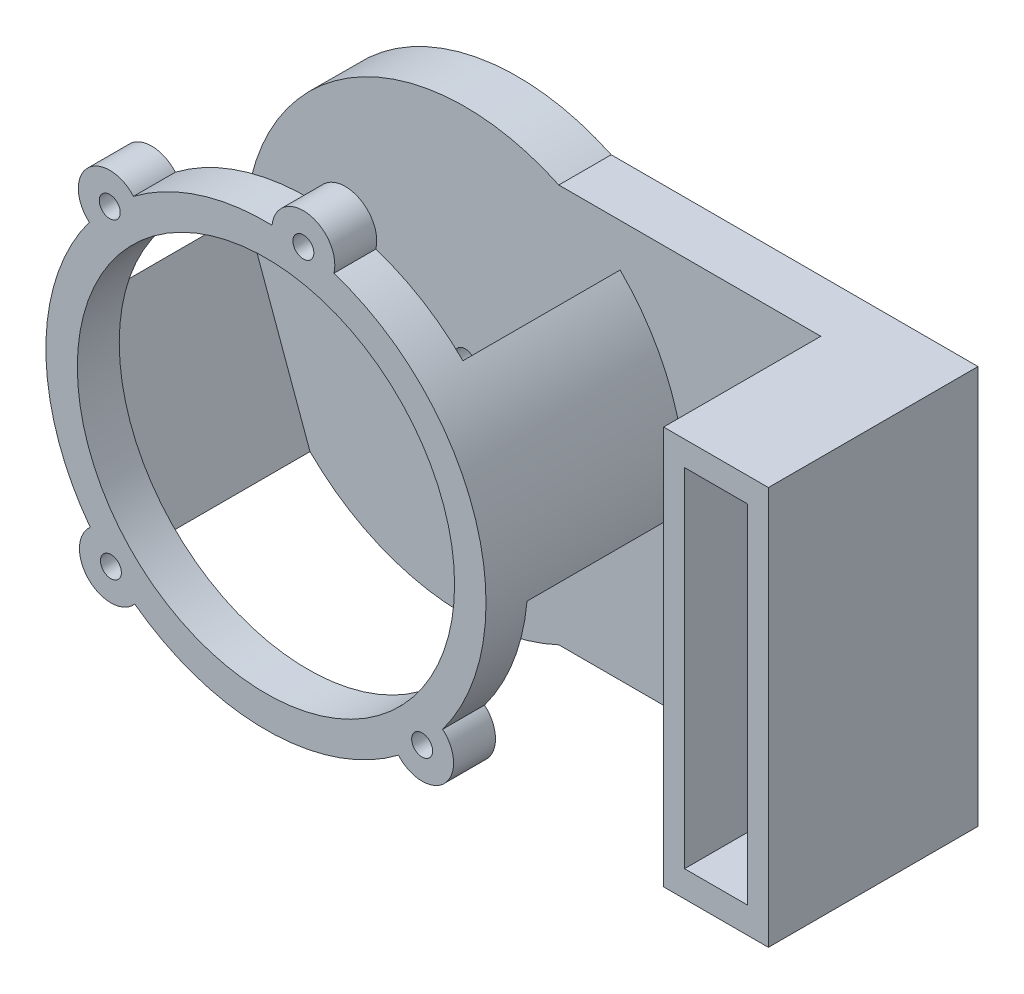
from build123d import *

# Parameters (mm, degrees)
ESTRUSIONE_ESTRUSIONE1_DEPTH = 2.5
SCHIZZO2_W                   = 10
SCHIZZO2_H                   = 38
ESTRUSIONE_ESTRUSIONE2_DEPTH = 15
SCHIZZO3_W                   = 6
SCHIZZO3_H                   = 33.15
TAGLIO_ESTRUSIONE1_DEPTH     = 13
ESTRUSIONE_SOTTILE1_START    = 19
SCHIZZO5_R                   = 21
SCHIZZO5_R_2                 = 18
ESTRUSIONE_SOTTILE1_DEPTH    = 19
SCHIZZO8_W                   = 38
SCHIZZO8_H                   = 15
TAGLIO_ESTRUSIONE2_DEPTH     = 70.157520353
SCHIZZO10_R                  = 3
ESTRUSIONE_ESTRUSIONE3_DEPTH = 4
FORO_PER_VITE_M1_6_1_D       = 2
FORO_PER_VITE_M1_6_1_DEPTH   = 3
FORO_PER_VITE_M1_6_1_TIP     = 0.600860619
SCHIZZO12_R                  = 1
TAGLIO_ESTRUSIONE3_DEPTH     = 3


with BuildPart() as part:
    # Schizzo1 → Estrusione-Estrusione1 (new, symmetric)
    with BuildSketch(Plane.XY):
        with BuildLine():
            Line((12.36549987, -26.390648792), (47.36549987, -26.390648792))
            Line((47.36549987, -26.390648792), (47.36549987, 11.609351208))
            Line((47.36549987, 11.609351208), (12.36549987, 11.609351208))
            ThreePointArc((12.36549987, 11.609351208), (-17.57877204, -7.390648792), (12.36549987, -26.390648792))
        make_face()
    extrude(amount=ESTRUSIONE_ESTRUSIONE1_DEPTH, both=True)

    # Schizzo2 → Estrusione-Estrusione2 (add)
    with BuildSketch(Plane.XY.offset(2.5)):
        with Locations((42.36549987, -7.390648792)):
            Rectangle(SCHIZZO2_W, SCHIZZO2_H)
    extrude(amount=ESTRUSIONE_ESTRUSIONE2_DEPTH)

    # Schizzo3 → Taglio-Estrusione1 (cut)
    with BuildSketch(Plane.XY.offset(17.5)):
        with Locations((42.36549987, -7.315648792)):
            Rectangle(SCHIZZO3_W, SCHIZZO3_H)
    extrude(amount=-TAGLIO_ESTRUSIONE1_DEPTH, mode=Mode.SUBTRACT)

    # Schizzo5 → Estrusione-Sottile1 (add)
    with BuildSketch(Plane.XY.offset(2.5).offset(ESTRUSIONE_SOTTILE1_START)):
        with Locations((3.42122796, -7.390648792)):
            Circle(SCHIZZO5_R)
        with Locations((3.42122796, -7.390648792)):
            Circle(SCHIZZO5_R_2, mode=Mode.SUBTRACT)
    extrude(amount=-ESTRUSIONE_SOTTILE1_DEPTH)

    # Schizzo8 → Taglio-Estrusione2 (cut, through all)
    with BuildSketch(Plane(origin=(-4.406906628, 12.10787645, 0), x_dir=(0.9396926207859102, 0.3420201433256638, 0), z_dir=(-0.3420201433256638, 0.9396926207859102, 0))):
        with Locations((0.687151909, -10)):
            Rectangle(SCHIZZO8_W, SCHIZZO8_H)
    extrude(amount=-TAGLIO_ESTRUSIONE2_DEPTH, mode=Mode.SUBTRACT)

    # Schizzo10 → Estrusione-Estrusione3 (add)
    with BuildSketch(Plane.XY.offset(21.5)):
        with Locations((-11.482021075, 7.404389842)):
            Circle(SCHIZZO10_R)
        with Locations((18.324476995, -22.185687427)):
            Circle(SCHIZZO10_R)
        with Locations((-11.373810674, -22.293897828)):
            Circle(SCHIZZO10_R)
        with Locations((6.992461631, 13.303463657)):
            Circle(SCHIZZO10_R)
    extrude(amount=-ESTRUSIONE_ESTRUSIONE3_DEPTH)

    # Foro per Vite M1.6-1
    with Locations(Plane(origin=(6.992461631, 13.303463657, 21.5), x_dir=(1, 0, 0), z_dir=(0, 0, 1))):
        with Locations((0, 0), (-18.474482706, -5.899073815), (-18.366272305, -35.597361485), (11.332015364, -35.489151084)):
            Hole(FORO_PER_VITE_M1_6_1_D / 2, depth=FORO_PER_VITE_M1_6_1_DEPTH)
            with Locations((0, 0, -(FORO_PER_VITE_M1_6_1_DEPTH + FORO_PER_VITE_M1_6_1_TIP / 2))):  # 118° drill point
                Cone(0, FORO_PER_VITE_M1_6_1_D / 2, FORO_PER_VITE_M1_6_1_TIP, mode=Mode.SUBTRACT)

    # Schizzo12 → Taglio-Estrusione3 (cut)
    with BuildSketch(Plane.XY.offset(2.5)):
        with Locations((3.42122796, -7.390648792)):
            Circle(SCHIZZO12_R)
    extrude(amount=-TAGLIO_ESTRUSIONE3_DEPTH, mode=Mode.SUBTRACT)


solid = part.part
